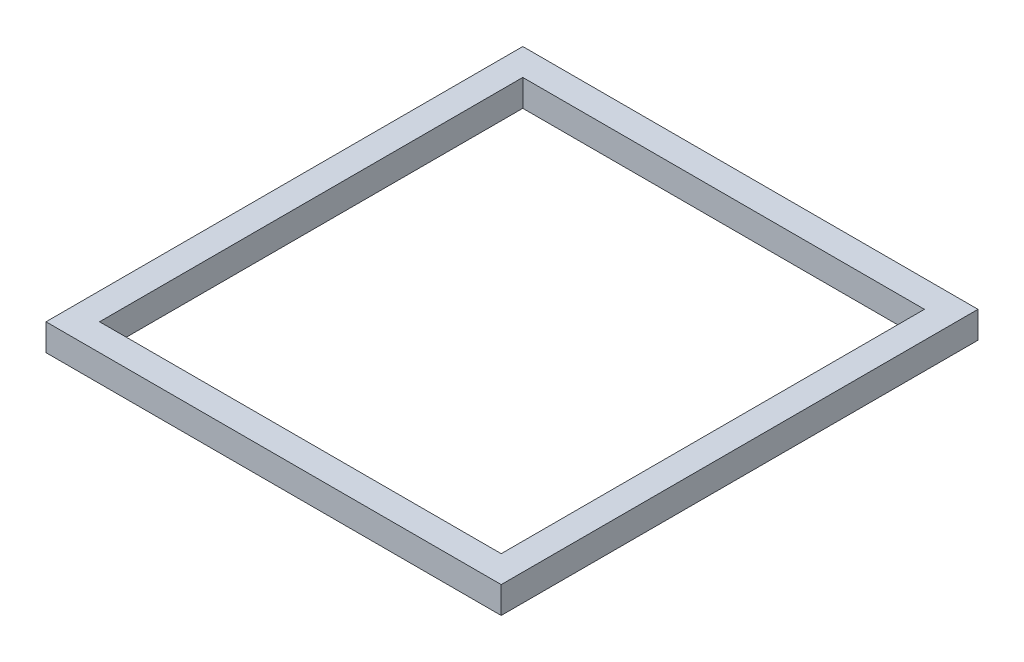
from build123d import *

# Parameters (mm, degrees)
SKETCH1_W           = 26.9875
SKETCH1_H           = 28.2675
SKETCH1_W_2         = 23.8125
SKETCH1_H_2         = 25.0925
BOSS_EXTRUDE1_DEPTH = 1.5875


with BuildPart() as part:
    # Sketch1 → Boss-Extrude1 (new body)
    with BuildSketch(Plane(origin=(0, 0, 0), x_dir=(1, 0, 0), z_dir=(0, 1, 0))):
        with Locations((13.49375, 14.13375)):
            Rectangle(SKETCH1_W, SKETCH1_H)
        with Locations((13.49375, 14.13375)):
            Rectangle(SKETCH1_W_2, SKETCH1_H_2, mode=Mode.SUBTRACT)
    extrude(amount=BOSS_EXTRUDE1_DEPTH)


solid = part.part
